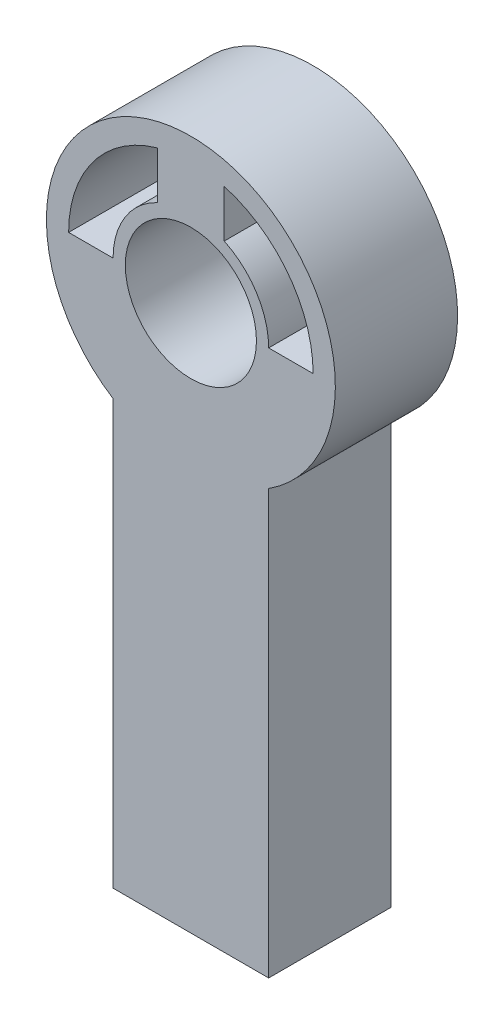
from build123d import *
from build123d.topology import SkipClean

# Parameters (mm, degrees)
SKETCH1_R               = 2.95
BOSS_EXTRUDE1_DEPTH     = 3.7
CUT_EXTRUDE1_DEPTH      = 10
CUT_EXTRUDE1_DEPTH_BACK = 10
SKETCH2_W               = 0.6
SKETCH2_H               = 16.95
SKETCH3_R               = 2.95
SKETCH3_R_2             = 1.5
BOSS_EXTRUDE2_DEPTH     = 3.1
SKETCH4_R               = 2.5
CUT_EXTRUDE2_DEPTH      = 1.5
SKETCH5_R               = 1.5
BOSS_EXTRUDE3_DEPTH     = 0.4
SKETCH6_R               = 2.95
BOSS_EXTRUDE4_DEPTH     = 2.4
SKETCH7_W               = 22.104564564
SKETCH7_H               = 50.546801486
CUT_EXTRUDE3_DEPTH      = 0.6
SKETCH8_R               = 1.5
BOSS_EXTRUDE5_DEPTH     = 2.6
BOSS_EXTRUDE6_START     = -5.5
SKETCH9_R               = 5.5
SKETCH9_R_2             = 3.5
BOSS_EXTRUDE6_DEPTH     = 5.5
SKETCH10_W              = 7
SKETCH10_H              = 7
CUT_EXTRUDE4_DEPTH      = 5.5
SKETCH11_W              = 20.865326807
SKETCH11_H              = 17.809349761
CUT_EXTRUDE5_DEPTH      = 10


with BuildPart() as part:
    # Sketch1 → Boss-Extrude1 (new body)
    with BuildSketch(Plane.XY):
        with BuildLine():
            Line((-3.5, -5.477225575), (-3.5, -29.522774425))
            ThreePointArc((-3.5, -29.522774425), (0, -41.5), (3.5, -29.522774425))
            Line((3.5, -29.522774425), (3.5, -5.477225575))
            ThreePointArc((3.5, -5.477225575), (0, 6.5), (-3.5, -5.477225575))
        make_face()
        with BuildLine():
            Line((-3.5, 0), (-5.5, 0))
            ThreePointArc((-5.5, 0), (-4.387482194, 3.31662479), (-1.5, 5.291502622))
            Line((-1.5, 5.291502622), (-1.5, 3.16227766))
            ThreePointArc((-1.5, 3.16227766), (-2.958039892, 1.870828693), (-3.5, 0))
        make_face(mode=Mode.SUBTRACT)
        with BuildLine():
            ThreePointArc((1.5, 5.291502622), (4.387482194, 3.31662479), (5.5, 0))
            Line((5.5, 0), (3.5, 0))
            ThreePointArc((3.5, 0), (2.958039892, 1.870828693), (1.5, 3.16227766))
            Line((1.5, 3.16227766), (1.5, 5.291502622))
        make_face(mode=Mode.SUBTRACT)
        Circle(SKETCH1_R, mode=Mode.SUBTRACT)
        with BuildLine():
            ThreePointArc((-1.5, -40.291502622), (-4.387482194, -38.31662479), (-5.5, -35))
            Line((-5.5, -35), (-3.5, -35))
            ThreePointArc((-3.5, -35), (-2.958039892, -36.870828693), (-1.5, -38.16227766))
            Line((-1.5, -38.16227766), (-1.5, -40.291502622))
        make_face(mode=Mode.SUBTRACT)
        with BuildLine():
            ThreePointArc((5.5, -35), (4.387482194, -38.31662479), (1.5, -40.291502622))
            Line((1.5, -40.291502622), (1.5, -38.16227766))
            ThreePointArc((1.5, -38.16227766), (2.958039892, -36.870828693), (3.5, -35))
            Line((3.5, -35), (5.5, -35))
        make_face(mode=Mode.SUBTRACT)
        with Locations((0, -35)):
            Circle(SKETCH1_R, mode=Mode.SUBTRACT)
    extrude(amount=BOSS_EXTRUDE1_DEPTH)

    # Sketch2 → Cut-Extrude1 (cut, two sides: drawn at the far end of the back side and taken through both)
    with BuildSketch(Plane(origin=(0, 0, 0), x_dir=(0, 0, -1), z_dir=(1, 0, 0)).offset(-CUT_EXTRUDE1_DEPTH_BACK)):
        with Locations((-3.4, -33.025)):
            Rectangle(SKETCH2_W, SKETCH2_H)
    extrude(amount=CUT_EXTRUDE1_DEPTH + CUT_EXTRUDE1_DEPTH_BACK, mode=Mode.SUBTRACT)

    # Sketch3 → Boss-Extrude2 (add)
    with BuildSketch(Plane(origin=(0, 0, 0), x_dir=(-1, 0, 0), z_dir=(0, 0, -1))):
        with Locations((0, -35)):
            Circle(SKETCH3_R)
        with Locations((0, -35)):
            Circle(SKETCH3_R_2, mode=Mode.SUBTRACT)
    extrude(amount=-BOSS_EXTRUDE2_DEPTH)

    # Sketch4 → Cut-Extrude2 (cut)
    with BuildSketch(Plane(origin=(0, 0, 0), x_dir=(-1, 0, 0), z_dir=(0, 0, -1))):
        with Locations((0, -35)):
            Circle(SKETCH4_R)
    extrude(amount=-CUT_EXTRUDE2_DEPTH, mode=Mode.SUBTRACT)

    # Sketch5 → Boss-Extrude3 (add)
    with SkipClean():  # the faces are left unmerged after this step: merging them gives an invalid solid
        with BuildSketch(Plane.XY.offset(3.1)):
            with BuildLine():
                Line((3.5, -24.55), (-3.5, -24.55))
                Line((-3.5, -24.55), (-3.5, -29.522774425))
                ThreePointArc((-3.5, -29.522774425), (0, -41.5), (3.5, -29.522774425))
                Line((3.5, -29.522774425), (3.5, -24.55))
            make_face()
            with BuildLine():
                Line((-5.5, -35), (-3.5, -35))
                ThreePointArc((-3.5, -35), (-2.958039892, -36.870828693), (-1.5, -38.16227766))
                Line((-1.5, -38.16227766), (-1.5, -40.291502622))
                ThreePointArc((-1.5, -40.291502622), (-4.387482194, -38.31662479), (-5.5, -35))
            make_face(mode=Mode.SUBTRACT)
            with BuildLine():
                ThreePointArc((5.5, -35), (4.387482194, -38.31662479), (1.5, -40.291502622))
                Line((1.5, -40.291502622), (1.5, -38.16227766))
                ThreePointArc((1.5, -38.16227766), (2.958039892, -36.870828693), (3.5, -35))
                Line((3.5, -35), (5.5, -35))
            make_face(mode=Mode.SUBTRACT)
            with Locations((0, -35)):
                Circle(SKETCH5_R, mode=Mode.SUBTRACT)
        extrude(amount=BOSS_EXTRUDE3_DEPTH)

    # Sketch6 → Boss-Extrude4 (add)
    with SkipClean():  # the faces are left unmerged after this step: merging them gives an invalid solid
        with BuildSketch(Plane.XY.offset(3.7)):
            with BuildLine():
                Line((-3.5, -5.477225575), (-3.5, -24.55))
                Line((-3.5, -24.55), (3.5, -24.55))
                Line((3.5, -24.55), (3.5, -5.477225575))
                ThreePointArc((3.5, -5.477225575), (0, 6.5), (-3.5, -5.477225575))
            make_face()
            Circle(SKETCH6_R, mode=Mode.SUBTRACT)
            with BuildLine():
                Line((-1.5, 5.291502622), (-1.5, 3.16227766))
                ThreePointArc((-1.5, 3.16227766), (-2.958039892, 1.870828693), (-3.5, 0))
                Line((-3.5, 0), (-5.5, 0))
                ThreePointArc((-5.5, 0), (-4.387482194, 3.31662479), (-1.5, 5.291502622))
            make_face(mode=Mode.SUBTRACT)
            with BuildLine():
                Line((1.5, 5.291502622), (1.5, 3.16227766))
                ThreePointArc((1.5, 3.16227766), (2.958039892, 1.870828693), (3.5, 0))
                Line((3.5, 0), (5.5, 0))
                ThreePointArc((5.5, 0), (4.387482194, 3.31662479), (1.5, 5.291502622))
            make_face(mode=Mode.SUBTRACT)
        extrude(amount=BOSS_EXTRUDE4_DEPTH)

    # Sketch7 → Cut-Extrude3 (cut)
    with SkipClean():  # the faces are left unmerged after this step: merging them gives an invalid solid
        with BuildSketch(Plane.XY):
            with Locations((0.952758093, -17.453923436)):
                Rectangle(SKETCH7_W, SKETCH7_H)
        extrude(amount=CUT_EXTRUDE3_DEPTH, mode=Mode.SUBTRACT)

    # Sketch8 → Boss-Extrude5 (add)
    with BuildSketch(Plane.XY.offset(3.5)):
        with BuildLine():
            Line((3.5, -29.522774425), (3.5, -24.55))
            Line((3.5, -24.55), (-3.5, -24.55))
            Line((-3.5, -24.55), (-3.5, -29.522774425))
            ThreePointArc((-3.5, -29.522774425), (0, -41.5), (3.5, -29.522774425))
        make_face()
        with BuildLine():
            Line((1.5, -40.291502622), (1.5, -38.16227766))
            ThreePointArc((1.5, -38.16227766), (2.958039892, -36.870828693), (3.5, -35))
            Line((3.5, -35), (5.5, -35))
            ThreePointArc((5.5, -35), (4.387482194, -38.31662479), (1.5, -40.291502622))
        make_face(mode=Mode.SUBTRACT)
        with BuildLine():
            Line((-1.5, -38.16227766), (-1.5, -40.291502622))
            ThreePointArc((-1.5, -40.291502622), (-4.387482194, -38.31662479), (-5.5, -35))
            Line((-5.5, -35), (-3.5, -35))
            ThreePointArc((-3.5, -35), (-2.958039892, -36.870828693), (-1.5, -38.16227766))
        make_face(mode=Mode.SUBTRACT)
        with Locations((0, -35)):
            Circle(SKETCH8_R, mode=Mode.SUBTRACT)
    extrude(amount=BOSS_EXTRUDE5_DEPTH)

    # Sketch9 → Boss-Extrude6 (add)
    with BuildSketch(Plane.XY.offset(6.1).offset(BOSS_EXTRUDE6_START)):
        with Locations((0, -35)):
            Circle(SKETCH9_R)
        with Locations((0, -35)):
            Circle(SKETCH9_R_2, mode=Mode.SUBTRACT)
    extrude(amount=BOSS_EXTRUDE6_DEPTH)

    # Sketch10 → Cut-Extrude4 (cut)
    with BuildSketch(Plane.XY.offset(6.1)):
        with Locations((0, -35)):
            Rectangle(SKETCH10_W, SKETCH10_H)
    extrude(amount=-CUT_EXTRUDE4_DEPTH, mode=Mode.SUBTRACT)

    # Sketch11 → Cut-Extrude5 (cut)
    with BuildSketch(Plane.XY.offset(6.1)):
        with Locations((0.447606021, -33.454674881)):
            Rectangle(SKETCH11_W, SKETCH11_H)
    extrude(amount=-CUT_EXTRUDE5_DEPTH, mode=Mode.SUBTRACT)


solid = part.part
